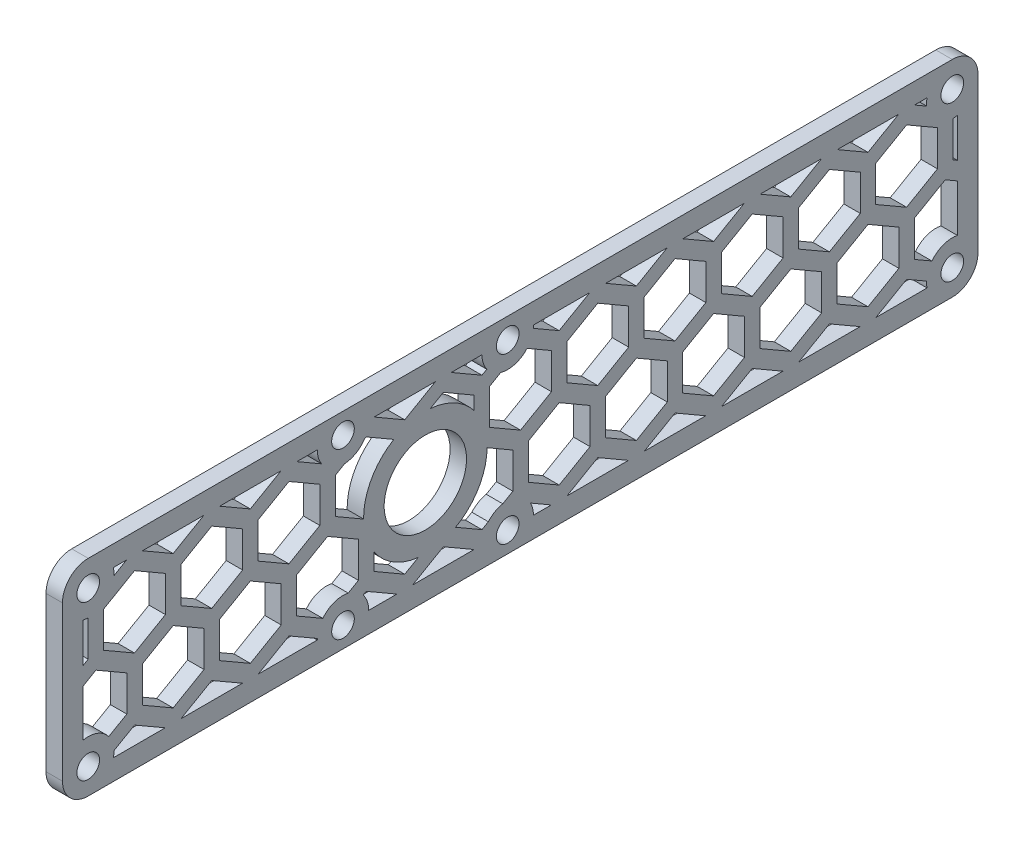
from build123d import *

# Parameters (mm, degrees)
STOCK_BODY_PITCH_GIMBAL_BOX_MASTER_1_START   = -83.2
STOCK_BODY_PITCH_GIMBAL_BOX_MASTER_1_OUT_W   = 40
STOCK_BODY_PITCH_GIMBAL_BOX_MASTER_1_OUT_H   = 177.87
STOCK_BODY_PITCH_GIMBAL_BOX_MASTER_1_OUT_R   = 2.2
STOCK_BODY_PITCH_GIMBAL_BOX_MASTER_1_OUT_R_2 = 8
STOCK_BODY_PITCH_GIMBAL_BOX_MASTER_1_DEPTH   = 3.2
SKETCH1_R                                    = 8
BOSS_EXTRUDE1_DEPTH                          = 3.2
SKETCH1_4_R                                  = 8
CUT_EXTRUDE2_DEPTH                           = 110.263703488
CUT_EXTRUDE3_DEPTH                           = 110.263703488
FILL_START                                   = -83.2
FILL_PATTERN2_DEPTH                          = 3.2
SKETCH3_R                                    = 12
BOSS_EXTRUDE2_DEPTH                          = 3.2
CUT_EXTRUDE4_START                           = -3.2
CUT_EXTRUDE4_OUTLINE_R                       = 8
CUT_EXTRUDE4_DEPTH                           = 3.2
FILLET1_R                                    = 5


# Read off the part's stored shape, not the designer's step: Stock-body_pitch_gimbal_box_master-1, Fill Pattern2, Cut-Extrude4
with BuildPart() as part:
    # Stock-body_pitch_gimbal_box_master-1 out → Stock-body_pitch_gimbal_box_master-1 (new body)
    with BuildSketch(Plane.YZ.offset(STOCK_BODY_PITCH_GIMBAL_BOX_MASTER_1_START)):
        with Locations((0, -18.435)):
            Rectangle(STOCK_BODY_PITCH_GIMBAL_BOX_MASTER_1_OUT_W, STOCK_BODY_PITCH_GIMBAL_BOX_MASTER_1_OUT_H)
        with Locations((-15, -102.37)):
            Circle(STOCK_BODY_PITCH_GIMBAL_BOX_MASTER_1_OUT_R, mode=Mode.SUBTRACT)
        with Locations((15, -102.37)):
            Circle(STOCK_BODY_PITCH_GIMBAL_BOX_MASTER_1_OUT_R, mode=Mode.SUBTRACT)
        with Locations((-16, -16)):
            Circle(STOCK_BODY_PITCH_GIMBAL_BOX_MASTER_1_OUT_R, mode=Mode.SUBTRACT)
        with Locations((-16, 16)):
            Circle(STOCK_BODY_PITCH_GIMBAL_BOX_MASTER_1_OUT_R, mode=Mode.SUBTRACT)
        with Locations((-15, 65.5)):
            Circle(STOCK_BODY_PITCH_GIMBAL_BOX_MASTER_1_OUT_R, mode=Mode.SUBTRACT)
        Circle(STOCK_BODY_PITCH_GIMBAL_BOX_MASTER_1_OUT_R_2, mode=Mode.SUBTRACT)
        with Locations((16, -16)):
            Circle(STOCK_BODY_PITCH_GIMBAL_BOX_MASTER_1_OUT_R, mode=Mode.SUBTRACT)
        with Locations((16, 16)):
            Circle(STOCK_BODY_PITCH_GIMBAL_BOX_MASTER_1_OUT_R, mode=Mode.SUBTRACT)
        with Locations((15, 65.5)):
            Circle(STOCK_BODY_PITCH_GIMBAL_BOX_MASTER_1_OUT_R, mode=Mode.SUBTRACT)
    extrude(amount=STOCK_BODY_PITCH_GIMBAL_BOX_MASTER_1_DEPTH)

    # Sketch1<4> → Cut-Extrude2 (cut, through all)
    with BuildSketch(Plane(origin=(-80, 0, 0), x_dir=(0, 0, -1), z_dir=(1, 0, 0))):
        with BuildLine():
            ThreePointArc((97.471020514, -16), (98.834466094, -11.464466094), (103.37, -10.101020514))
            Line((103.37, -10.101020514), (103.37, 10.101020514))
            ThreePointArc((103.37, 10.101020514), (98.834466094, 11.464466094), (97.471020514, 16))
            Line((97.471020514, 16), (21, 16))
            ThreePointArc((21, 16), (16, 11), (11, 16))
            Line((11, 16), (-11, 16))
            ThreePointArc((-11, 16), (-16, 11), (-21, 16))
            Line((-21, 16), (-60.601020514, 16))
            ThreePointArc((-60.601020514, 16), (-60.525319235, 15.50254481), (-60.5, 15))
            ThreePointArc((-60.5, 15), (-62.33772234, 11.127016654), (-66.5, 10.101020514))
            Line((-66.5, 10.101020514), (-66.5, -10.101020514))
            ThreePointArc((-66.5, -10.101020514), (-62.33772234, -11.127016654), (-60.5, -15))
            ThreePointArc((-60.5, -15), (-60.525319235, -15.50254481), (-60.601020514, -16))
            Line((-60.601020514, -16), (-21, -16))
            ThreePointArc((-21, -16), (-16, -11), (-11, -16))
            Line((-11, -16), (11, -16))
            ThreePointArc((11, -16), (16, -11), (21, -16))
            Line((21, -16), (97.471020514, -16))
        make_face()
        Circle(SKETCH1_4_R, mode=Mode.SUBTRACT)
    extrude(amount=-CUT_EXTRUDE2_DEPTH, mode=Mode.SUBTRACT)


with BuildPart() as body_2:
    # Sketch1 → Boss-Extrude1 (new body)
    # profile 1 of 2: a face of its own
    with BuildSketch(Plane(origin=(-80, 0, 0), x_dir=(0, 0, -1), z_dir=(1, 0, 0))):
        with BuildLine():
            ThreePointArc((97.471020514, -16), (98.834466094, -11.464466094), (103.37, -10.101020514))
            Line((103.37, -10.101020514), (103.37, 10.101020514))
            ThreePointArc((103.37, 10.101020514), (98.834466094, 11.464466094), (97.471020514, 16))
            Line((97.471020514, 16), (21, 16))
            ThreePointArc((21, 16), (16, 11), (11, 16))
            Line((11, 16), (-11, 16))
            ThreePointArc((-11, 16), (-16, 11), (-21, 16))
            Line((-21, 16), (-60.601020514, 16))
            ThreePointArc((-60.601020514, 16), (-60.525319235, 15.50254481), (-60.5, 15))
            ThreePointArc((-60.5, 15), (-62.33772234, 11.127016654), (-66.5, 10.101020514))
            Line((-66.5, 10.101020514), (-66.5, -10.101020514))
            ThreePointArc((-66.5, -10.101020514), (-62.33772234, -11.127016654), (-60.5, -15))
            ThreePointArc((-60.5, -15), (-60.525319235, -15.50254481), (-60.601020514, -16))
            Line((-60.601020514, -16), (-21, -16))
            ThreePointArc((-21, -16), (-16, -11), (-11, -16))
            Line((-11, -16), (11, -16))
            ThreePointArc((11, -16), (16, -11), (21, -16))
            Line((21, -16), (97.471020514, -16))
        make_face()
        Circle(SKETCH1_R, mode=Mode.SUBTRACT)
    # profile 2 of 2: a face of its own
    with BuildSketch(Plane(origin=(-80, 0, 0), x_dir=(0, 0, -1), z_dir=(1, 0, 0))):
        Circle(SKETCH1_R)
    extrude(amount=-BOSS_EXTRUDE1_DEPTH)

    # Sketch2 → Cut-Extrude3 (cut, through all)
    with BuildSketch(Plane.ZY.offset(83.2)):
        Polygon((-57.5, 9.959292144), (-63.5, 13.423393759), (-69.5, 9.959292144), (-69.5, 3.031088913), (-63.5, -0.433012702), (-57.5, 3.031088913), align=None)
        Polygon((-50, -3.031088913), (-56, 0.433012702), (-62, -3.031088913), (-62, -9.959292144), (-56, -13.423393759), (-50, -9.959292144), align=None)
    extrude(amount=-CUT_EXTRUDE3_DEPTH, mode=Mode.SUBTRACT)

    # Fill Pattern2 outline → Fill Pattern2 (cut)
    with BuildSketch(Plane.YZ.offset(FILL_START)):
        Polygon((16, -46.962812921), (16, -35.037187079), (12.557368355, -41), align=None)
        with BuildLine():
            Line((12.557368355, -26), (16, -31.962812921))
            Line((16, -31.962812921), (16, -21))
            ThreePointArc((16, -21), (15.730079086, -20.992708954), (15.460945374, -20.97085708))
            Line((15.460945374, -20.97085708), (12.557368355, -26))
        make_face()
        Polygon((16, -61.962812921), (16, -50.037187079), (12.557368355, -56), align=None)
        Polygon((16, -76.962812921), (16, -65.037187079), (12.557368355, -71), align=None)
        with BuildLine():
            Line((9.959292144, -24.5), (12.698707999, -19.755192555))
            ThreePointArc((12.698707999, -19.755192555), (11.203551183, -17.412118531), (11.190591021, -14.632672215))
            Line((11.190591021, -14.632672215), (9.959292144, -12.5))
            Line((9.959292144, -12.5), (3.031088913, -12.5))
            Line((3.031088913, -12.5), (-0.433012702, -18.5))
            Line((-0.433012702, -18.5), (3.031088913, -24.5))
            Line((3.031088913, -24.5), (9.959292144, -24.5))
        make_face()
        Polygon((16, -91.962812921), (16, -80.037187079), (12.557368355, -86), align=None)
        with BuildLine():
            Line((12.557368355, -11), (13.094704364, -11.930693269))
            ThreePointArc((13.094704364, -11.930693269), (14.474636708, -11.238354609), (16, -11))
            Line((16, -11), (16, -5.037187079))
            Line((16, -5.037187079), (12.557368355, -11))
        make_face()
        with BuildLine():
            Line((16, -97.471020514), (16, -95.037187079))
            Line((16, -95.037187079), (14.645901586, -97.38255433))
            ThreePointArc((14.645901586, -97.38255433), (15.32596592, -97.380636692), (16, -97.471020514))
        make_face()
        Polygon((12.557368355, 4), (16, -1.962812921), (16, 9.962812921), align=None)
        with BuildLine():
            ThreePointArc((10.101020514, -103.37), (10.036851453, -102.975934405), (10.004328491, -102.578005243))
            Line((10.004328491, -102.578005243), (9.959292144, -102.5))
            Line((9.959292144, -102.5), (3.031088913, -102.5))
            Line((3.031088913, -102.5), (2.528794179, -103.37))
            Line((2.528794179, -103.37), (10.101020514, -103.37))
        make_face()
        with BuildLine():
            Line((13.423393759, 11.5), (13.227703198, 11.838945994))
            ThreePointArc((13.227703198, 11.838945994), (11.669872981, 13.5), (11.010273123, 15.679647545))
            Line((11.010273123, 15.679647545), (9.959292144, 17.5))
            Line((9.959292144, 17.5), (3.031088913, 17.5))
            Line((3.031088913, 17.5), (-0.433012702, 11.5))
            Line((-0.433012702, 11.5), (3.031088913, 5.5))
            Line((3.031088913, 5.5), (9.959292144, 5.5))
            Line((9.959292144, 5.5), (13.423393759, 11.5))
        make_face()
        with BuildLine():
            Line((-10.101020514, -103.37), (-0.935307436, -103.37))
            Line((-0.935307436, -103.37), (0.433012702, -101))
            Line((0.433012702, -101), (-3.031088913, -95))
            Line((-3.031088913, -95), (-9.959292144, -95))
            Line((-9.959292144, -95), (-11.93402679, -98.420340739))
            ThreePointArc((-11.93402679, -98.420340739), (-10.311194229, -100.633595542), (-10.101020514, -103.37))
        make_face()
        with BuildLine():
            Line((16, 24.962812921), (13.227703198, 20.161054006))
            ThreePointArc((13.227703198, 20.161054006), (14.551771777, 20.785669756), (16, 21))
            Line((16, 21), (16, 24.962812921))
        make_face()
        with BuildLine():
            ThreePointArc((-16, -97.471020514), (-15.400018323, -97.386027152), (-14.794161146, -97.37423876))
            Line((-14.794161146, -97.37423876), (-12.557368355, -93.5))
            Line((-12.557368355, -93.5), (-16, -87.537187079))
            Line((-16, -87.537187079), (-16, -97.471020514))
        make_face()
        Polygon((12.557368355, 34), (16, 28.037187079), (16, 39.962812921), align=None)
        Polygon((12.557368355, 49), (16, 43.037187079), (16, 54.962812921), align=None)
        Polygon((-16, -72.537187079), (-16, -84.462812921), (-12.557368355, -78.5), align=None)
        with BuildLine():
            Line((14.567262409, 60.518761381), (16, 58.037187079))
            Line((16, 58.037187079), (16, 60.601020514))
            ThreePointArc((16, 60.601020514), (15.286597804, 60.508220588), (14.567262409, 60.518761381))
        make_face()
        Polygon((-16, -57.537187079), (-16, -69.462812921), (-12.557368355, -63.5), align=None)
        with BuildLine():
            Line((9.959292144, 65.5), (10.000509692, 65.571390888))
            ThreePointArc((10.000509692, 65.571390888), (10.029033817, 66.038047596), (10.101020514, 66.5))
            Line((10.101020514, 66.5), (2.453738644, 66.5))
            Line((2.453738644, 66.5), (3.031088913, 65.5))
            Line((3.031088913, 65.5), (9.959292144, 65.5))
        make_face()
        Polygon((-16, -42.537187079), (-16, -54.462812921), (-12.557368355, -48.5), align=None)
        Polygon((-16, -27.537187079), (-16, -39.462812921), (-12.557368355, -33.5), align=None)
        with BuildLine():
            Line((0.433012702, 64), (-1.010362971, 66.5))
            Line((-1.010362971, 66.5), (-10.101020514, 66.5))
            ThreePointArc((-10.101020514, 66.5), (-10.322677567, 63.732896478), (-11.986071317, 61.510484504))
            Line((-11.986071317, 61.510484504), (-9.959292144, 58))
            Line((-9.959292144, 58), (-3.031088913, 58))
            Line((-3.031088913, 58), (0.433012702, 64))
        make_face()
        with BuildLine():
            Line((-16, -21), (-16, -24.462812921))
            Line((-16, -24.462812921), (-13.667335283, -20.422519115))
            ThreePointArc((-13.667335283, -20.422519115), (-14.798458401, -20.853483057), (-16, -21))
        make_face()
        with BuildLine():
            Line((-12.557368355, 56.5), (-14.867778955, 60.501748546))
            ThreePointArc((-14.867778955, 60.501748546), (-15.436719372, 60.519108896), (-16, 60.601020514))
            Line((-16, 60.601020514), (-16, 50.537187079))
            Line((-16, 50.537187079), (-12.557368355, 56.5))
        make_face()
        with BuildLine():
            ThreePointArc((-12.710843255, -12.234173676), (-11.669872981, -13.5), (-11.094120364, -15.034419864))
            Line((-11.094120364, -15.034419864), (-9.959292144, -17))
            Line((-9.959292144, -17), (-3.031088913, -17))
            Line((-3.031088913, -17), (0.433012702, -11))
            Line((0.433012702, -11), (-3.031088913, -5))
            Line((-3.031088913, -5), (-9.959292144, -5))
            Line((-9.959292144, -5), (-13.423393759, -11))
            Line((-13.423393759, -11), (-12.710843255, -12.234173676))
        make_face()
        Polygon((-12.557368355, 41.5), (-16, 47.462812921), (-16, 35.537187079), align=None)
        Polygon((-16, 2.462812921), (-16, -9.462812921), (-12.557368355, -3.5), align=None)
        with BuildLine():
            Line((-12.557368355, 26.5), (-16, 32.462812921))
            Line((-16, 32.462812921), (-16, 21))
            ThreePointArc((-16, 21), (-15.868352983, 20.998266606), (-15.736797244, 20.993067625))
            Line((-15.736797244, 20.993067625), (-12.557368355, 26.5))
        make_face()
        with BuildLine():
            Line((-16, 11), (-16, 5.537187079))
            Line((-16, 5.537187079), (-12.557368355, 11.5))
            Line((-12.557368355, 11.5), (-12.893475836, 12.082155233))
            ThreePointArc((-12.893475836, 12.082155233), (-14.355193603, 11.278282948), (-16, 11))
        make_face()
        with BuildLine():
            Line((-9.959292144, 25), (-12.893475836, 19.917844767))
            ThreePointArc((-12.893475836, 19.917844767), (-11.299418215, 17.704268432), (-11.104430455, 14.983437738))
            Line((-11.104430455, 14.983437738), (-9.959292144, 13))
            Line((-9.959292144, 13), (-3.031088913, 13))
            Line((-3.031088913, 13), (0.433012702, 19))
            Line((0.433012702, 19), (-3.031088913, 25))
            Line((-3.031088913, 25), (-9.959292144, 25))
        make_face()
        Polygon((-3.031088913, -80), (-9.959292144, -80), (-13.423393759, -86), (-9.959292144, -92), (-3.031088913, -92), (0.433012702, -86), align=None)
        Polygon((-9.959292144, -35), (-13.423393759, -41), (-9.959292144, -47), (-3.031088913, -47), (0.433012702, -41), (-3.031088913, -35), align=None)
        Polygon((9.959292144, -27.5), (3.031088913, -27.5), (-0.433012702, -33.5), (3.031088913, -39.5), (9.959292144, -39.5), (13.423393759, -33.5), align=None)
        Polygon((3.031088913, -72.5), (-0.433012702, -78.5), (3.031088913, -84.5), (9.959292144, -84.5), (13.423393759, -78.5), (9.959292144, -72.5), align=None)
        Polygon((3.031088913, -54.5), (9.959292144, -54.5), (13.423393759, -48.5), (9.959292144, -42.5), (3.031088913, -42.5), (-0.433012702, -48.5), align=None)
        Polygon((-9.959292144, -77), (-3.031088913, -77), (0.433012702, -71), (-3.031088913, -65), (-9.959292144, -65), (-13.423393759, -71), align=None)
        Polygon((-9.959292144, -32), (-3.031088913, -32), (0.433012702, -26), (-3.031088913, -20), (-9.959292144, -20), (-13.423393759, -26), align=None)
        Polygon((3.031088913, -9.5), (9.959292144, -9.5), (13.423393759, -3.5), (9.959292144, 2.5), (3.031088913, 2.5), (-0.433012702, -3.5), align=None)
        Polygon((9.959292144, -99.5), (13.423393759, -93.5), (9.959292144, -87.5), (3.031088913, -87.5), (-0.433012702, -93.5), (3.031088913, -99.5), align=None)
        Polygon((-9.959292144, -2), (-3.031088913, -2), (0.433012702, 4), (-3.031088913, 10), (-9.959292144, 10), (-13.423393759, 4), align=None)
        Polygon((3.031088913, 20.5), (9.959292144, 20.5), (13.423393759, 26.5), (9.959292144, 32.5), (3.031088913, 32.5), (-0.433012702, 26.5), align=None)
        Polygon((3.031088913, 50.5), (9.959292144, 50.5), (13.423393759, 56.5), (9.959292144, 62.5), (3.031088913, 62.5), (-0.433012702, 56.5), align=None)
        Polygon((-9.959292144, 28), (-3.031088913, 28), (0.433012702, 34), (-3.031088913, 40), (-9.959292144, 40), (-13.423393759, 34), align=None)
        Polygon((3.031088913, 35.5), (9.959292144, 35.5), (13.423393759, 41.5), (9.959292144, 47.5), (3.031088913, 47.5), (-0.433012702, 41.5), align=None)
        Polygon((-9.959292144, 43), (-3.031088913, 43), (0.433012702, 49), (-3.031088913, 55), (-9.959292144, 55), (-13.423393759, 49), align=None)
    extrude(amount=FILL_PATTERN2_DEPTH, mode=Mode.SUBTRACT)


with BuildPart() as part_1:
    add(part.part)

    # Combine2: union body 2
    add(body_2.part)

    # Sketch3 → Boss-Extrude2 (add)
    with BuildSketch(Plane(origin=(-80, 0, 0), x_dir=(0, 0, -1), z_dir=(1, 0, 0))):
        Circle(SKETCH3_R)
    extrude(amount=-BOSS_EXTRUDE2_DEPTH)

    # Cut-Extrude4 outline → Cut-Extrude4 (cut)
    with BuildSketch(Plane(origin=(-80, 0, 0), x_dir=(0, 0, -1), z_dir=(1, 0, 0)).offset(CUT_EXTRUDE4_START)):
        Circle(CUT_EXTRUDE4_OUTLINE_R)
    extrude(amount=CUT_EXTRUDE4_DEPTH, mode=Mode.SUBTRACT)

    # Fillet1
    fillet1_edges = [part_1.edges().sort_by_distance(p)[0] for p in [
        (-81.6, 20, -107.37),
        (-81.6, 20, 70.5),
        (-81.6, -20, 70.5),
        (-81.6, -20, -107.37),
    ]]
    fillet(fillet1_edges, radius=FILLET1_R)


solid = part_1.part
